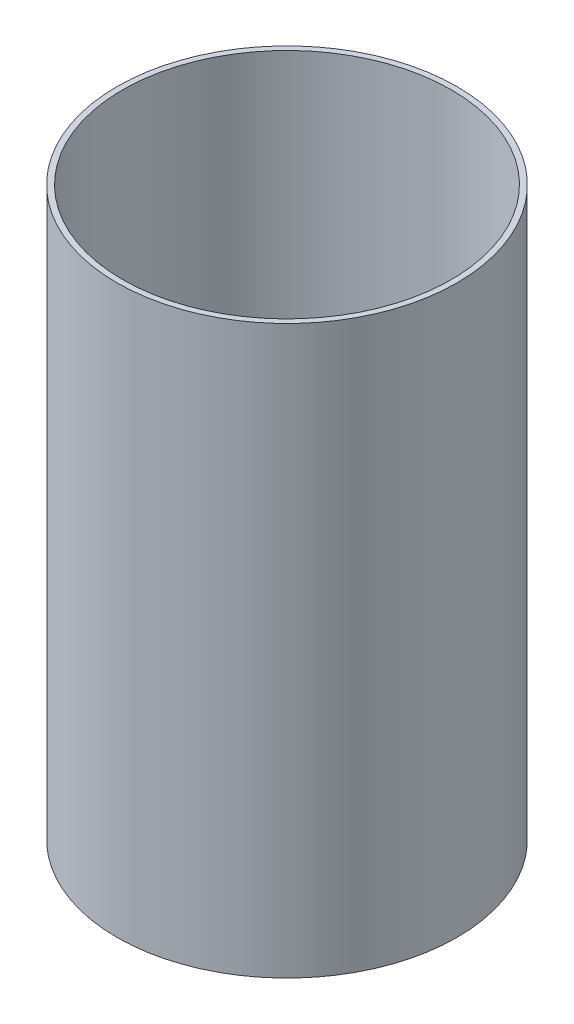
from build123d import *

# Parameters (mm, degrees)
SKETCH1_R           = 76.1746
SKETCH1_R_2         = 73.66
BOSS_EXTRUDE1_DEPTH = 254


with BuildPart() as part:
    # Sketch1 → Boss-Extrude1 (new body)
    with BuildSketch(Plane(origin=(0, 0, 0), x_dir=(1, 0, 0), z_dir=(0, 1, 0))):
        Circle(SKETCH1_R)
        Circle(SKETCH1_R_2, mode=Mode.SUBTRACT)
    extrude(amount=BOSS_EXTRUDE1_DEPTH)


solid = part.part
